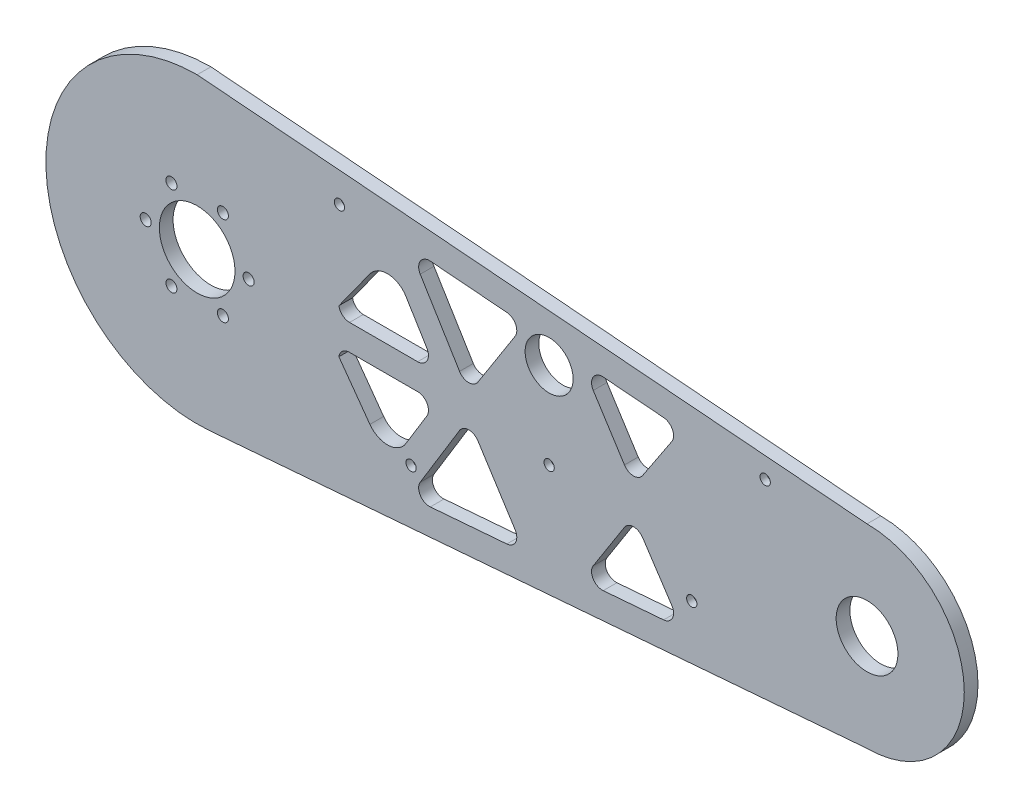
from build123d import *

# Parameters (mm, degrees)
SKETCH1_R              = 14.29385
SKETCH1_R_2            = 11.1125
BOSS_EXTRUDE1_DEPTH    = 6.35
CROQUIS1_R             = 2.38125
CORTAR_EXTRUIR1_DEPTH  = 50
CROQUIS6_R             = 2.38125
CORTAR_EXTRUIR6_DEPTH  = 10
CROQUIS8_R             = 17.5
CORTAR_EXTRUIR8_DEPTH  = 10
CROQUIS9_R             = 2.5527
CORTAR_EXTRUIR9_DEPTH  = 10
CROQUIS5_R             = 2.38125
CORTAR_EXTRUIR5_DEPTH  = 10
CROQUIS10_R            = 5
CORTAR_EXTRUIR10_DEPTH = 3.18


with BuildPart() as part:
    # Sketch1 → Boss-Extrude1 (new body)
    with BuildSketch(Plane.XY):
        with BuildLine():
            Line((0, 70), (310, 45))
            ThreePointArc((310, 45), (355, 0), (310, -45))
            Line((310, -45), (5.171398252, -69.808714643))
            ThreePointArc((5.171398252, -69.808714643), (-69.952162315, -2.587467389), (0, 70))
        make_face()
        Circle(SKETCH1_R, mode=Mode.SUBTRACT)
        with Locations((310, 0)):
            Circle(SKETCH1_R, mode=Mode.SUBTRACT)
        with Locations((162.878542763, 35)):
            Circle(SKETCH1_R_2, mode=Mode.SUBTRACT)
        with BuildLine():
            Line((107.898974887, 49.259511156), (143.314248041, 46.40344074))
            ThreePointArc((143.314248041, 46.40344074), (147.389908855, 43.644764005), (147.127454118, 38.730252238))
            Line((147.127454118, 38.730252238), (129.916226305, 11.754586611))
            ThreePointArc((129.916226305, 11.754586611), (125.651076231, 9.444205574), (121.433006579, 11.839462159))
            Line((121.433006579, 11.839462159), (103.228961238, 41.671198203))
            ThreePointArc((103.228961238, 41.671198203), (103.238833139, 46.896293531), (107.898974887, 49.259511156))
        make_face(mode=Mode.SUBTRACT)
        with BuildLine():
            Line((70.523244027, 6), (102.03004784, 6))
            ThreePointArc((102.03004784, 6), (106.3902351, 8.552804247), (106.298140539, 13.604493178))
            Line((106.298140539, 13.604493178), (96.590354482, 29.513051181))
            ThreePointArc((96.590354482, 29.513051181), (88.437172177, 34.296727565), (79.941746192, 30.151166228))
            Line((79.941746192, 30.151166228), (65.58297828, 10.229432452))
            ThreePointArc((65.58297828, 10.229432452), (67.271539685, 7.201787411), (70.523244027, 6))
        make_face(mode=Mode.SUBTRACT)
        with BuildLine():
            Line((219.623774494, 32.810522613), (206.130928429, 12.417497436))
            ThreePointArc((206.130928429, 12.417497436), (201.919524559, 10.176643248), (197.745901529, 12.48710226))
            Line((197.745901529, 12.48710226), (183.296864227, 35.133505128))
            ThreePointArc((183.296864227, 35.133505128), (183.227765467, 40.400743015), (187.913912204, 42.80669363))
            Line((187.913912204, 42.80669363), (215.855795571, 40.553315939))
            ThreePointArc((215.855795571, 40.553315939), (219.949772588, 37.757395035), (219.623774494, 32.810522613))
        make_face(mode=Mode.SUBTRACT)
        with BuildLine():
            Line((96.590354482, -29.513051181), (106.298140539, -13.604493178))
            ThreePointArc((106.298140539, -13.604493178), (106.3902351, -8.552804247), (102.03004784, -6))
            Line((102.03004784, -6), (70.523244027, -6))
            ThreePointArc((70.523244027, -6), (67.271539685, -7.201787411), (65.58297828, -10.229432452))
            Line((65.58297828, -10.229432452), (79.941746192, -30.151166228))
            ThreePointArc((79.941746192, -30.151166228), (88.437172177, -34.296727565), (96.590354482, -29.513051181))
        make_face(mode=Mode.SUBTRACT)
        with BuildLine():
            Line((187.913912204, -42.80669363), (215.855795571, -40.553315939))
            ThreePointArc((215.855795571, -40.553315939), (219.949772588, -37.757395035), (219.623774494, -32.810522613))
            Line((219.623774494, -32.810522613), (206.130928429, -12.417497436))
            ThreePointArc((206.130928429, -12.417497436), (201.919524559, -10.176643248), (197.745901529, -12.48710226))
            Line((197.745901529, -12.48710226), (183.296864227, -35.133505128))
            ThreePointArc((183.296864227, -35.133505128), (183.227765467, -40.400743015), (187.913912204, -42.80669363))
        make_face(mode=Mode.SUBTRACT)
        with BuildLine():
            Line((121.433006579, -11.839462159), (103.228961238, -41.671198203))
            ThreePointArc((103.228961238, -41.671198203), (103.238833139, -46.896293531), (107.898974887, -49.259511156))
            Line((107.898974887, -49.259511156), (143.314248041, -46.40344074))
            ThreePointArc((143.314248041, -46.40344074), (147.389908855, -43.644764005), (147.127454118, -38.730252238))
            Line((147.127454118, -38.730252238), (129.916226305, -11.754586611))
            ThreePointArc((129.916226305, -11.754586611), (125.651076231, -9.444205574), (121.433006579, -11.839462159))
        make_face(mode=Mode.SUBTRACT)
    extrude(amount=BOSS_EXTRUDE1_DEPTH)

    # Croquis1 → Cortar-Extruir1 (cut)
    with BuildSketch(Plane.XY.offset(6.35)):
        with Locations((98.995555235, -37.090103176)):
            Circle(CROQUIS1_R)
        with Locations((228.877351461, -26.519571404)):
            Circle(CROQUIS1_R)
    extrude(amount=-CORTAR_EXTRUIR1_DEPTH, mode=Mode.SUBTRACT)

    # Croquis6 → Cortar-Extruir6 (cut)
    with BuildSketch(Plane.XY.offset(6.35)):
        with Locations((65.84135797, 50.868973694)):
            Circle(CROQUIS6_R)
        with Locations((262.871569637, 39.210126075)):
            Circle(CROQUIS6_R)
    extrude(amount=-CORTAR_EXTRUIR6_DEPTH, mode=Mode.SUBTRACT)

    # Croquis8 → Cortar-Extruir8 (cut)
    with BuildSketch(Plane.XY.offset(6.35)):
        Circle(CROQUIS8_R)
    extrude(amount=-CORTAR_EXTRUIR8_DEPTH, mode=Mode.SUBTRACT)

    # Croquis9 → Cortar-Extruir9 (cut)
    with BuildSketch(Plane(origin=(0, 0, 0), x_dir=(-1, 0, 0), z_dir=(0, 0, -1))):
        with Locations((23.8125, 0)):
            Circle(CROQUIS9_R)
        with Locations((11.90625, -20.622229928)):
            Circle(CROQUIS9_R)
        with Locations((-11.90625, -20.622229928)):
            Circle(CROQUIS9_R)
        with Locations((-23.8125, 0)):
            Circle(CROQUIS9_R)
        with Locations((-11.90625, 20.622229928)):
            Circle(CROQUIS9_R)
        with Locations((11.90625, 20.622229928)):
            Circle(CROQUIS9_R)
    extrude(amount=-CORTAR_EXTRUIR9_DEPTH, mode=Mode.SUBTRACT)

    # Croquis5 → Cortar-Extruir5 (cut)
    with BuildSketch(Plane.XY.offset(6.35)):
        with Locations((162.878542763, -5)):
            Circle(CROQUIS5_R)
    extrude(amount=-CORTAR_EXTRUIR5_DEPTH, mode=Mode.SUBTRACT)

    # Croquis10 → Cortar-Extruir10 (cut)
    with BuildSketch(Plane(origin=(0, 0, 0), x_dir=(-1, 0, 0), z_dir=(0, 0, -1))):
        with Locations((-262.871569637, 39.210126075)):
            Circle(CROQUIS10_R)
        with Locations((-65.84135797, 50.868973694)):
            Circle(CROQUIS10_R)
        with Locations((-162.878542763, -5)):
            Circle(CROQUIS10_R)
        with Locations((-228.877351461, -26.519571404)):
            Circle(CROQUIS10_R)
        with Locations((-98.995555235, -37.090103176)):
            Circle(CROQUIS10_R)
    extrude(amount=-CORTAR_EXTRUIR10_DEPTH, mode=Mode.SUBTRACT)


solid = part.part
